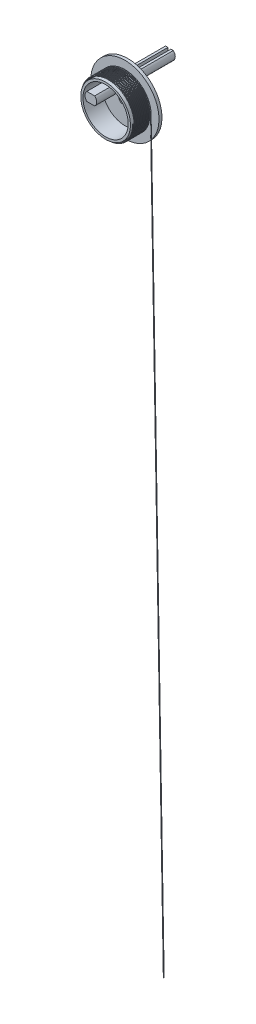
from build123d import *

# Parameters (mm, degrees)
AXEL_START            = -9.984944739
AXEL_DEPTH            = 53
AXEL_2_OUTLINE_W      = 5.9
AXEL_2_OUTLINE_H      = 2
AXEL_2_DEPTH          = 26
BODY_MOVE_COPY2_ANGLE = 90
CUT_EXTRUDE3_DEPTH    = 10
SKETCH4_R             = 2
CUT_EXTRUDE4_DEPTH    = 51.019995972
SWEEP1_PITCH          = 1
SKETCH7_R             = 0.2
BOSS_EXTRUDE3_DEPTH   = 500


with BuildPart() as part:
    # Sketch1 → Revolve1 (revolve)
    with BuildSketch(Plane(origin=(0, 0, 0), x_dir=(0, 0, -1), z_dir=(1, 0, 0)), mode=Mode.PRIVATE) as revolve1_sk:
        Polygon((-15, 15.25), (-2, 15.25), (-2, 0), (0, 0), (0, 23), (-2, 23), (-2, 16.75), (-15, 16.75), align=None)
    revolve(revolve1_sk.sketch.rotate(Axis((0, 0, 0), (0, 0, 1)), 90), axis=Axis((0, 0, 0), (0, 0, 1)))

    # Sketch3 → Cut-Extrude3 (cut)
    with BuildSketch(Plane.XY.offset(2)):
        with BuildLine():
            Line((-2.720294102, 3.2), (2.720294102, 3.2))
            ThreePointArc((2.720294102, 3.2), (4.2, 0), (2.720294102, -3.2))
            Line((2.720294102, -3.2), (-2.720294102, -3.2))
            ThreePointArc((-2.720294102, -3.2), (-4.2, 0), (-2.720294102, 3.2))
        make_face()
    extrude(amount=-CUT_EXTRUDE3_DEPTH, mode=Mode.SUBTRACT)

    # Sketch4 → Cut-Extrude4 (cut, through all)
    with BuildSketch(Plane(origin=(0, 0, 0), x_dir=(1, 0, 0), z_dir=(0, 1, 0))):
        with Locations(Location((-4, -4, 0), (0, 0, 90))):
            Circle(SKETCH4_R)
        with Locations(Location((4, -4, 0), (0, 0, 90))):
            Circle(SKETCH4_R)
    extrude(amount=CUT_EXTRUDE4_DEPTH, mode=Mode.SUBTRACT)


with BuildPart() as body_2:
    # Axel: read off the stored shape, not the designer's step
    # Axel outline → Axel (new body)
    with BuildSketch(Plane.YZ.offset(AXEL_START)):
        with BuildLine():
            Line((4.981747017, -3.492895029), (4.981747017, -1.866109922))
            ThreePointArc((4.981747017, -1.866109922), (2.031747017, -0.542895029), (-0.918252983, -1.866109922))
            Line((-0.918252983, -1.866109922), (-0.918252983, -3.492895029))
            Line((-0.918252983, -3.492895029), (4.981747017, -3.492895029))
        make_face()
        with BuildLine():
            Line((4.981747017, -7.119680137), (4.981747017, -5.492895029))
            Line((4.981747017, -5.492895029), (-0.918252983, -5.492895029))
            Line((-0.918252983, -5.492895029), (-0.918252983, -7.119680137))
            ThreePointArc((-0.918252983, -7.119680137), (2.031747017, -8.442895029), (4.981747017, -7.119680137))
        make_face()
    extrude(amount=AXEL_DEPTH)

    # Axel 2 outline → Axel 2 (add)
    with BuildSketch(Plane.YZ.offset(AXEL_START)):
        with Locations((2.031747017, -4.492895029)):
            Rectangle(AXEL_2_OUTLINE_W, AXEL_2_OUTLINE_H)
    extrude(amount=AXEL_2_DEPTH)


with BuildPart() as body_2_1:
    # Body-Move/Copy2: read off the stored shape, not the designer's step
    # Body-Move/Copy2: moved
    add(body_2.part.moved(Location((-5.0150553, 0, -5.4920497))).rotate(Axis((0, 0, 0), (0, 1, 0)), BODY_MOVE_COPY2_ANGLE))


with BuildPart() as body_3:
    # Sweep1: arcs per turn and ends read off the stored shape
    # Sweep1: the profile of Sketch6 screwed along a right-hand helix through 12 turns, 8 arcs to a turn; built about Z, then put on its axis
    sweep1_z = Axis((0, 0, 0), (0, 0, 1))
    sweep1_corners = [(17.688509838, 4.9396e-05, 0.997222667), (17.488509838, 4.8837e-05, 1.197222667), (17.288509838, 4.8279e-05, 0.997222667), (17.488509838, 4.8837e-05, 0.797222667)]
    with BuildLine(mode=Mode.PRIVATE) as sweep1_profile:
        ThreePointArc((17.688509838, 4.9396e-05, 0.997222667), (17.629931194, 4.9232e-05, 1.138644023), (17.488509838, 4.8837e-05, 1.197222667))
        ThreePointArc((17.488509838, 4.8837e-05, 1.197222667), (17.347088482, 4.8442e-05, 1.138644023), (17.288509838, 4.8279e-05, 0.997222667))
        ThreePointArc((17.288509838, 4.8279e-05, 0.997222667), (17.347088482, 4.8442e-05, 0.85580131), (17.488509838, 4.8837e-05, 0.797222667))
        ThreePointArc((17.488509838, 4.8837e-05, 0.797222667), (17.629931194, 4.9232e-05, 0.85580131), (17.688509838, 4.9396e-05, 0.997222667))
    sweep1_cap = Face(sweep1_profile.wire())
    sweep1_arcs = [((17.688509838, 4.9396e-05, 0.997222667), (17.688509838, 4.9396e-05, 1.197222667), (17.488509838, 4.8837e-05, 1.197222667), (1, 0.7071067811865476, 1)), ((17.488509838, 4.8837e-05, 1.197222667), (17.288509838, 4.8279e-05, 1.197222667), (17.288509838, 4.8279e-05, 0.997222667), (1, 0.7071067811865476, 1)), ((17.288509838, 4.8279e-05, 0.997222667), (17.288509838, 4.8279e-05, 0.797222667), (17.488509838, 4.8837e-05, 0.797222667), (1, 0.7071067811865476, 1)), ((17.488509838, 4.8837e-05, 0.797222667), (17.688509838, 4.9396e-05, 0.797222667), (17.688509838, 4.9396e-05, 0.997222667), (1, 0.7071067811865476, 1))]  # start, shoulder, end, weights
    sweep1_turn_angles = [0, 22.5, 45, 67.5, 90, 112.5, 135, 157.5, 180, 202.5, 225, 247.5, 270, 292.5, 315, 337.5, 360]
    sweep1_turn_weights = [1, 0.9238795325112867, 1, 0.9238795325112867, 1, 0.9238795325112867, 1, 0.9238795325112867, 1, 0.9238795325112867, 1, 0.9238795325112867, 1, 0.9238795325112867, 1, 0.9238795325112867, 1]
    sweep1_turn_sides = [Face.make_bezier_surface([[Vector(p[j][0], p[j][1], 0).rotate(sweep1_z, sweep1_turn_angles[2 * i + k]) / sweep1_turn_weights[2 * i + k] + Vector(0, 0, p[j][2] + SWEEP1_PITCH * sweep1_turn_angles[2 * i + k] / 360) for k in range(3)] for j in range(3)], [[p[3][j] * sweep1_turn_weights[2 * i + k] for k in range(3)] for j in range(3)]) for p in sweep1_arcs for i in range(8)]
    sweep1 = Plane(origin=(0, 0, 15), x_dir=(0.9998476951563912, 0.017452406437290343, 0), z_dir=(0, 0, -1)) * Solid(Shell([*[p.moved(Location((0, 0, SWEEP1_PITCH * i))) for i in range(12) for p in sweep1_turn_sides], sweep1_cap, sweep1_cap.rotate(sweep1_z, 4320).moved(Location((0, 0, SWEEP1_PITCH * 4320 / 360)))]))
    add(sweep1)

    # Sketch7 → Boss-Extrude3 (add)
    with BuildSketch(Plane(origin=(0, 0, 0), x_dir=(-0.9998477432821179, -0.017449649098366132, 1.4969838855097968e-12), z_dir=(0.017449649098366132, -0.9998477432821179, 0))):
        with Locations(Location((-17.488509838, -2.002777339, 0), (0, 0, 180))):
            Circle(SKETCH7_R)
    extrude(amount=BOSS_EXTRUDE3_DEPTH)


solid = Compound([part.part, body_2_1.part, body_3.part])
